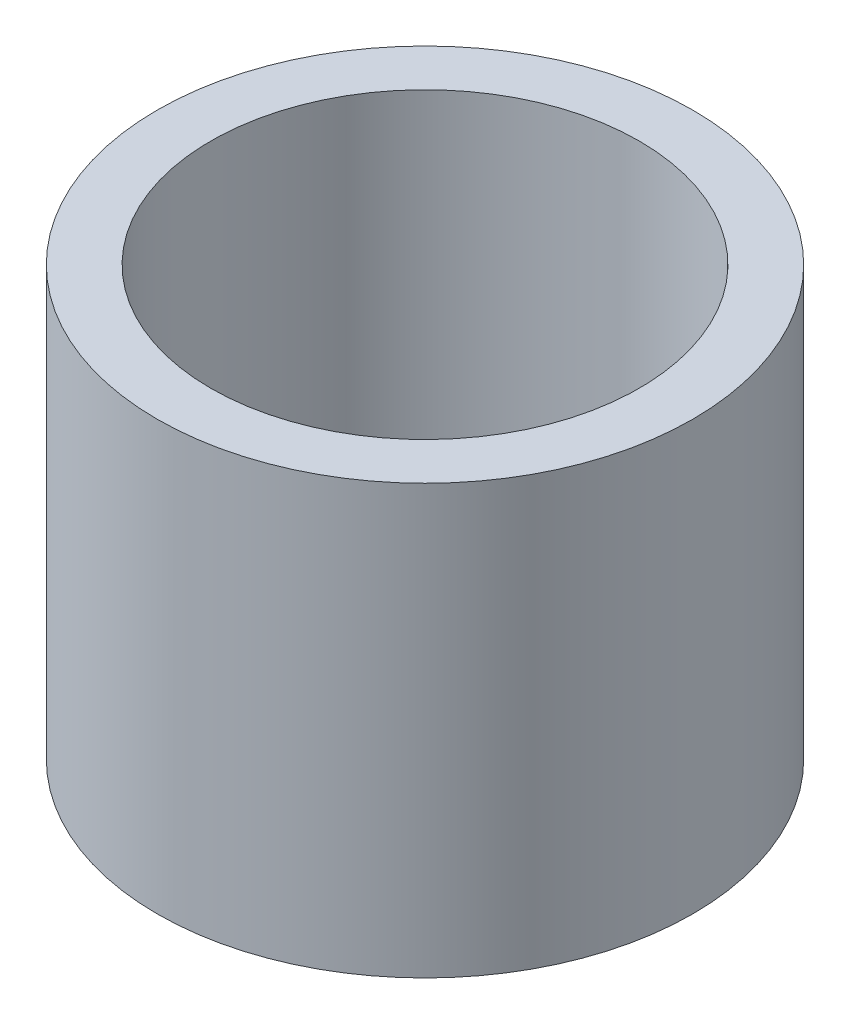
from build123d import *

# Parameters (mm, degrees)
SKETCH1_R           = 10
BOSS_EXTRUDE1_DEPTH = 16


with BuildPart() as part:
    # Sketch1 → Boss-Extrude1 (new body)
    with BuildSketch(Plane(origin=(0, 0, 0), x_dir=(1, 0, 0), z_dir=(0, 1, 0))):
        Circle(SKETCH1_R)
        with BuildLine():
            ThreePointArc((-8, 0), (0, 8), (8, 0))
            ThreePointArc((8, 0), (0, -8), (-8, 0))
        make_face(mode=Mode.SUBTRACT)
    extrude(amount=BOSS_EXTRUDE1_DEPTH)


solid = part.part
